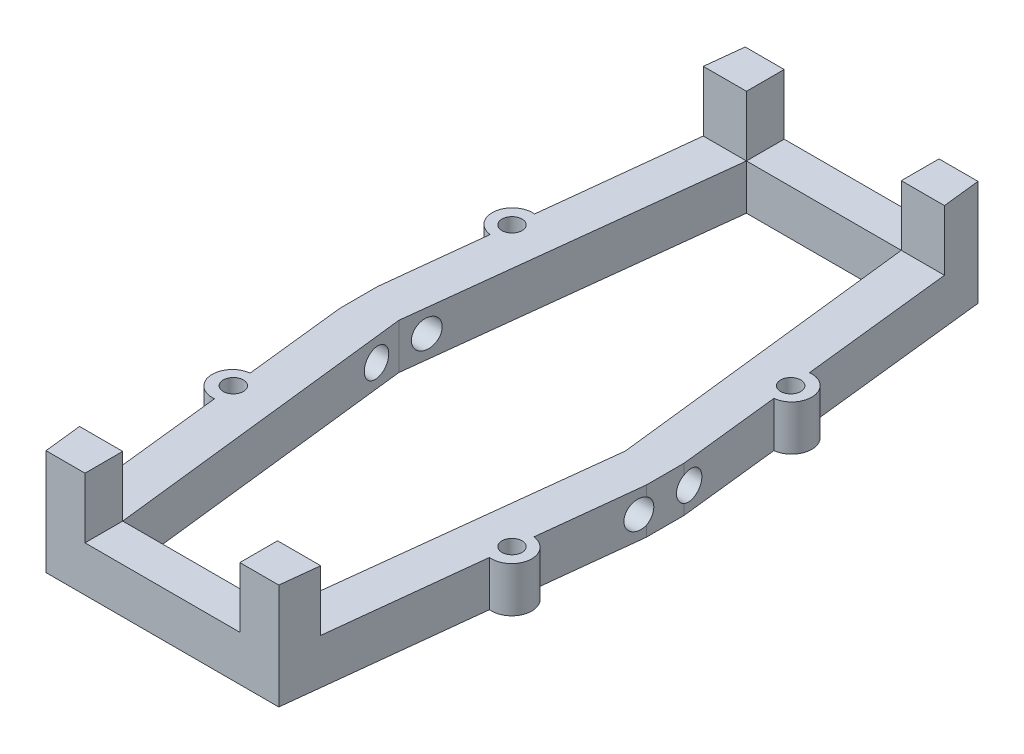
from build123d import *

# Parameters (mm, degrees)
BOSS_EXTRUDE1_DEPTH     = 4.5
BOSS_EXTRUDE5_DEPTH     = 6
SKETCH9_R               = 1
CUT_EXTRUDE2_DEPTH      = 10
CUT_EXTRUDE3_DEPTH      = 48.803846546
CUT_EXTRUDE3_DEPTH_BACK = 48.803846546
SKETCH11_R              = 1.375


with BuildPart() as part:
    # Sketch1 → Boss-Extrude1 (new body)
    with BuildSketch(Plane(origin=(0, 0, 0), x_dir=(1, 0, 0), z_dir=(0, 1, 0))):
        with BuildLine():
            Line((5.65, -1.875), (5.65, 1.875))
            Line((5.65, 1.875), (1.9, 1.875))
            Line((1.9, 1.875), (-1.875, -31))
            Line((-1.875, -31), (-17.265, -31))
            Line((-17.265, -31), (-21.04, 1.875))
            Line((-21.04, 1.875), (-24.79, 1.875))
            Line((-24.79, 1.875), (-24.79, -1.875))
            Line((-24.79, -1.875), (-23.673675208, -11.929569188))
            ThreePointArc((-23.673675208, -11.929569188), (-25.440763963, -14.138052226), (-23.232280925, -15.905140982))
            Line((-23.232280925, -15.905140982), (-21.14, -34.75))
            Line((-21.14, -34.75), (-19.14, -34.75))
            Line((-19.14, -34.75), (0, -34.75))
            Line((0, -34.75), (2, -34.75))
            Line((2, -34.75), (4.092280925, -15.905140982))
            ThreePointArc((4.092280925, -15.905140982), (6.300763963, -14.138052226), (4.533675208, -11.929569188))
            Line((4.533675208, -11.929569188), (5.65, -1.875))
        make_face()
    boss_extrude1 = extrude(amount=BOSS_EXTRUDE1_DEPTH)

    # Sketch7 → Boss-Extrude5 (add)
    with BuildSketch(Plane(origin=(0, 4.5, 0), x_dir=(1, 0, 0), z_dir=(0, 1, 0))):
        Polygon((-1.875, -31), (-1.875, -34.75), (2, -34.75), (2.41634981, -31), align=None)
        Polygon((-21.55634981, -31), (-17.265, -31), (-17.265, -34.75), (-21.14, -34.75), align=None)
    boss_extrude5 = extrude(amount=BOSS_EXTRUDE5_DEPTH)

    # Sketch9 → Cut-Extrude2 (cut)
    with BuildSketch(Plane(origin=(0, 4.5, 0), x_dir=(1, 0, 0), z_dir=(0, 1, 0))):
        with Locations((4.28, 13.85)):
            Circle(SKETCH9_R)
        with Locations((-23.42, 13.85)):
            Circle(SKETCH9_R)
        with Locations((-23.42, -13.85)):
            Circle(SKETCH9_R)
        with Locations((4.28, -13.85)):
            Circle(SKETCH9_R)
    cut_extrude2 = extrude(amount=-CUT_EXTRUDE2_DEPTH, mode=Mode.SUBTRACT)

    # Mirror1: Boss-Extrude1, Boss-Extrude5, Cut-Extrude2 across plane
    add(boss_extrude1.mirror(Plane.XY))
    add(boss_extrude5.mirror(Plane.XY))
    add(cut_extrude2.mirror(Plane.XY), mode=Mode.SUBTRACT)

    # Sketch11 → Cut-Extrude3 (cut, two sides: drawn at the far end of the back side and taken through both)
    with BuildSketch(Plane(origin=(5.65, 0, 0), x_dir=(0, 0, -1), z_dir=(1, 0, 0)).offset(-CUT_EXTRUDE3_DEPTH_BACK)):
        with Locations((-2.5, 2.25)):
            Circle(SKETCH11_R)
        with Locations((2.5, 2.25)):
            Circle(SKETCH11_R)
    extrude(amount=CUT_EXTRUDE3_DEPTH + CUT_EXTRUDE3_DEPTH_BACK, mode=Mode.SUBTRACT)


solid = part.part
